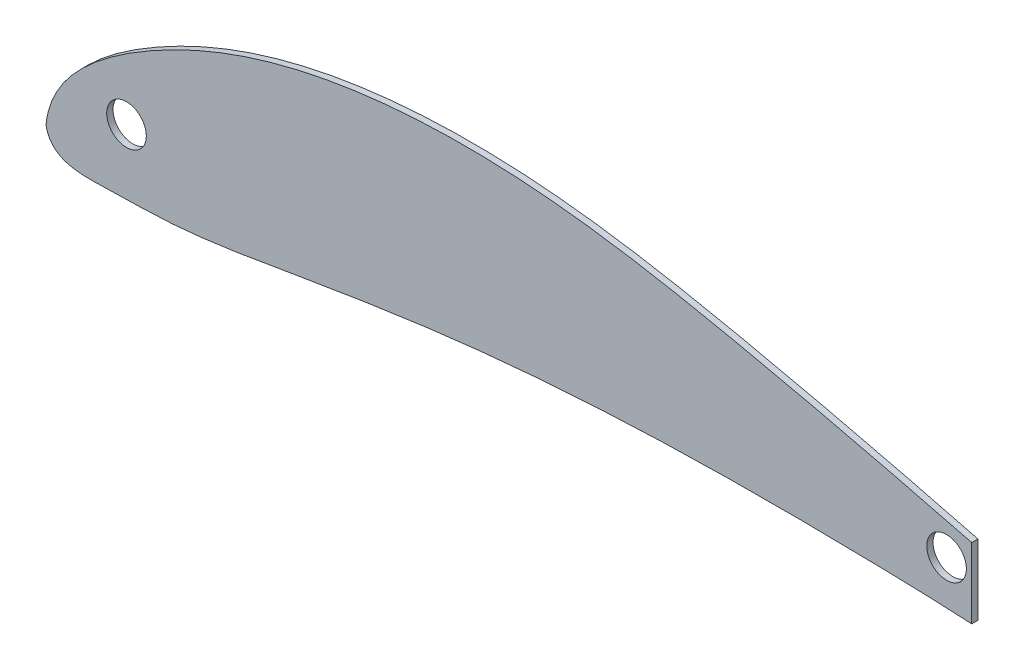
from build123d import *

# Parameters (mm, degrees)
BOSS_EXTRUDE1_DEPTH = 1.5875
SKETCH2_R           = 5
CUT_EXTRUDE1_DEPTH  = 316.731983488
SKETCH3_W           = 116.84
SKETCH3_H           = 50.8
CUT_EXTRUDE2_DEPTH  = 316.731983488


with BuildPart() as part:
    # Sketch1 → Boss-Extrude1 (new body)
    with BuildSketch(Plane.XY):
        with BuildLine():
            add(Edge.make_bspline(
                [(0.000560351, 0.000130087), (0.810633127, 7.359196055), (8.649092025, 17.856605174), (26.286719818, 29.975176328), (52.111128271, 42.069215275), (89.597618475, 49.290763054), (131.400792109, 47.884831915), (173.256699242, 40.041104278), (217.961060472, 29.612974894), (256.952064401, 19.528920948), (290.35983767, 8.71099439), (301.273197721, 4.382828139), (314.816918223, -0.516206742), (309.846313895, 0.000130087)],
                knots=[0, 0, 0, 0, 0.060863618, 0.113688265, 0.188608742, 0.312908923, 0.448482434, 0.557612135, 0.691544113, 0.852438279, 0.92975597, 0.976058229, 1, 1, 1, 1], degree=3))
            add(Edge.make_bspline(
                [(309.846313895, 0.000130087), (303.956832565, 1.47095521), (293.989507544, 2.093987313), (276.26402299, 4.514356704), (260.846344817, 5.427413394), (235.858814759, 7.870306192), (205.101424636, 8.838080282), (157.718638092, 9.030650149), (110.497331172, 6.181495223), (66.506197185, -0.586669107), (36.454672816, -6.098499901), (15.316603331, -6.189065841), (1.230714189, -6.924076091), (0.000560351, 0.000130087)],
                knots=[0, 0, 0, 0, 0.057787081, 0.095274891, 0.171021118, 0.205339302, 0.335319146, 0.464904334, 0.658702312, 0.785511947, 0.893517288, 0.94309214, 1, 1, 1, 1], degree=3))
        make_face()
    extrude(amount=BOSS_EXTRUDE1_DEPTH)

    # Sketch2 → Cut-Extrude1 (cut, through all)
    with BuildSketch(Plane.XY.offset(1.5875)):
        with Locations((20.32, 10.16)):
            Circle(SKETCH2_R)
        with Locations((227.296313895, 19.050130087)):
            Circle(SKETCH2_R)
    extrude(amount=-CUT_EXTRUDE1_DEPTH, mode=Mode.SUBTRACT)

    # Sketch3 → Cut-Extrude2 (cut, through all)
    with BuildSketch(Plane.XY.offset(1.5875)):
        with Locations((292.066313895, 19.050130087)):
            Rectangle(SKETCH3_W, SKETCH3_H)
    extrude(amount=-CUT_EXTRUDE2_DEPTH, mode=Mode.SUBTRACT)


solid = part.part
